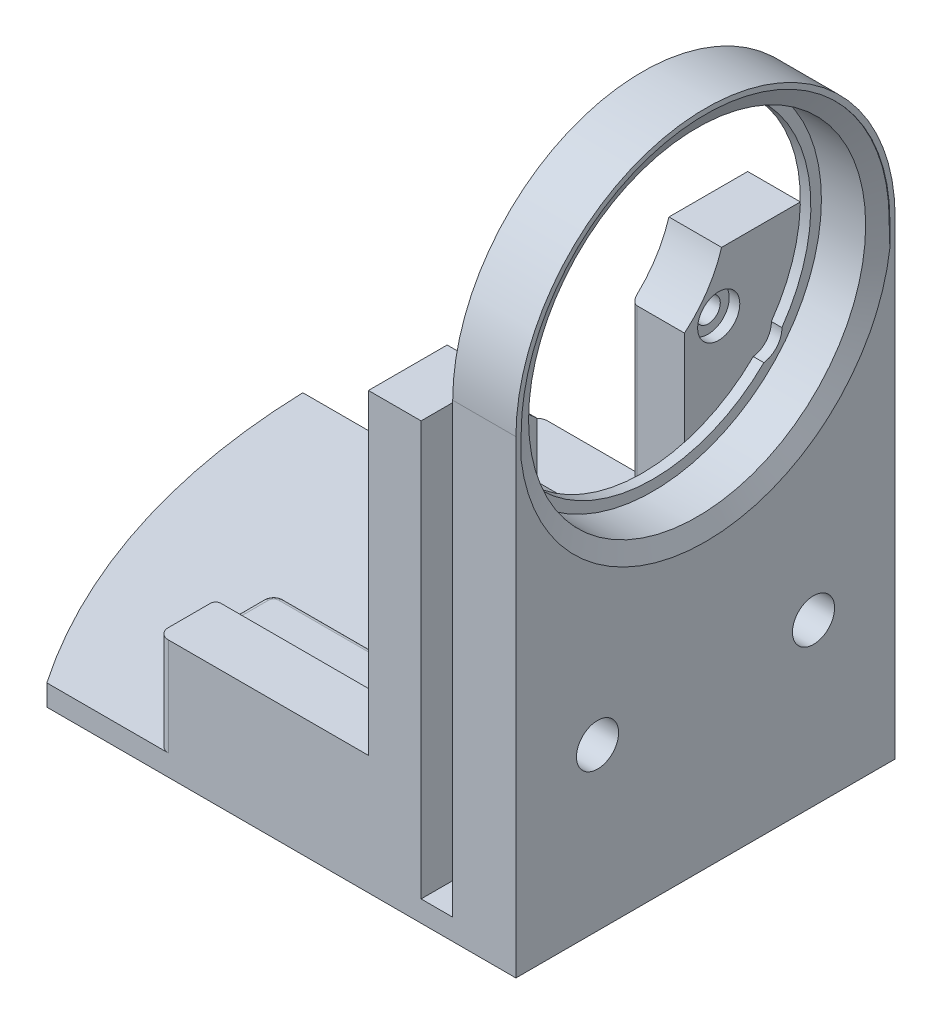
from build123d import *

# Parameters (mm, degrees)
EXTRUDE_1_DEPTH     = 2
SKETCH_2_W          = 6
SKETCH_2_H          = 35
EXTRUDE_2_DEPTH     = 60
FILLET_1_R          = 17.5
SKETCH_3_R          = 16
CUT_EXTRUDE_1_DEPTH = 5
CHAMFER_1_SIZE      = 1.640243073
CHAMFER_1_SIZE_2    = 0.8
SKETCH_4_R          = 15
CUT_EXTRUDE_2_DEPTH = 105.385422037
SKETCH_5_W          = 25
SKETCH_5_H          = 10.5
EXTRUDE_3_DEPTH     = 7.3
EXTRUDE_4_DEPTH     = 2
FILLET_2_R          = 1
EXTRUDE_5_DEPTH     = 5
SKETCH_9_R          = 1.15
CUT_EXTRUDE_3_DEPTH = 101.277297201
SKETCH_10_R         = 2
CUT_EXTRUDE_4_DEPTH = 10
FILLET_3_R          = 0.5
SKETCH_12_W         = 56.21
SKETCH_12_H         = 29.03
CUT_EXTRUDE_5_DEPTH = 113.159332301
BOSS_EXTRUDE1_DEPTH = 6
BOSS_EXTRUDE2_DEPTH = 0.5
BOSS_EXTRUDE3_DEPTH = 0.5
SKETCH5_W           = 0.5
SKETCH5_H           = 2
BOSS_EXTRUDE4_DEPTH = 2
CUT_EXTRUDE1_DEPTH  = 9
SKETCH6_W           = 1
SKETCH6_H           = 9.3
BOSS_EXTRUDE5_DEPTH = 2
SKETCH7_W           = 1
SKETCH7_H           = 9.3
BOSS_EXTRUDE7_DEPTH = 3
FILLET1_R           = 1


# Some blends are built 0.0001 mm under size
with BuildPart() as part:
    # 스케치1 → 보스-돌출1 (new body)
    with BuildSketch(Plane(origin=(0, 0, 0), x_dir=(1, 0, 0), z_dir=(0, 1, 0))):
        with BuildLine():
            Line((-11.24267666, -2.527135016), (-67.45267666, -2.527135016))
            ThreePointArc((-67.45267666, -2.527135016), (-50.72671765, -44.531450868), (-11.24267666, -66.557135016))
            Line((-11.24267666, -66.557135016), (-11.24267666, -2.527135016))
        make_face()
    extrude(amount=EXTRUDE_1_DEPTH)

    # 스케치2 → 보스-돌출2 (add)
    with BuildSketch(Plane(origin=(0, 2, 0), x_dir=(1, 0, 0), z_dir=(0, 1, 0))):
        with Locations((-14.24267666, -20.027135016)):
            Rectangle(SKETCH_2_W, SKETCH_2_H)
    extrude(amount=EXTRUDE_2_DEPTH)

    # 필렛1
    fillet_1_edges = [part.edges().sort_by_distance(p)[0] for p in [
        (-14.24267666, 62, 2.527135016),
        (-14.24267666, 62, 37.527135016),
    ]]
    fillet(fillet_1_edges, radius=FILLET_1_R - 0.0001)  # a hair under: the kernel refuses the full size

    # 스케치3 → 컷-돌출1 (cut)
    with BuildSketch(Plane(origin=(-11.24267666, 0, 0), x_dir=(0, 0, -1), z_dir=(1, 0, 0))):
        with Locations((-20.027135016, 44.5)):
            Circle(SKETCH_3_R)
    extrude(amount=-CUT_EXTRUDE_1_DEPTH, mode=Mode.SUBTRACT)

    # 모따기1
    # the kernel refuses this chamfer: 1.640243073, 0.8 mm, written as the material it takes off along each edge
    with BuildSketch(Plane(origin=(-11.24267666, 44.5, 20.027135016), x_dir=(0, 0, -1), z_dir=(0, -1, 0))) as chamfer_1_piece_1:
        Polygon((16 + CHAMFER_1_SIZE, 0), (16, -CHAMFER_1_SIZE_2), (16, 0), align=None)
    revolve(axis=Axis((-11.24267666, 44.5, 20.027135016), (1, 0, 0)), mode=Mode.SUBTRACT)

    # 스케치4 → 컷-돌출2 (cut, through all)
    with BuildSketch(Plane(origin=(-16.24267666, 0, 0), x_dir=(0, 0, -1), z_dir=(1, 0, 0))):
        with Locations((-20.027135016, 44.5)):
            Circle(SKETCH_4_R)
    extrude(amount=-CUT_EXTRUDE_2_DEPTH, mode=Mode.SUBTRACT)

    # 스케치5 → 보스-돌출3 (add)
    with BuildSketch(Plane(origin=(0, 2, 0), x_dir=(1, 0, 0), z_dir=(0, 1, 0))):
        with Locations((-32.74267666, -7.777135016)):
            Rectangle(SKETCH_5_W, SKETCH_5_H)
        with Locations((-32.74267666, -32.277135016)):
            Rectangle(SKETCH_5_W, SKETCH_5_H)
    extrude(amount=EXTRUDE_3_DEPTH)

    # 스케치6 → 보스-돌출4 (add)
    with BuildSketch(Plane(origin=(0, 9.3, 0), x_dir=(1, 0, 0), z_dir=(0, 1, 0))):
        Polygon((-45.24267666, -32.527135016), (-25.24267666, -32.527135016), (-25.24267666, -27.027135016), (-20.24267666, -27.027135016), (-20.24267666, -37.527135016), (-45.24267666, -37.527135016), align=None)
        Polygon((-45.24267666, -2.527135016), (-20.24267666, -2.527135016), (-20.24267666, -13.027135016), (-25.24267666, -13.027135016), (-25.24267666, -7.527135016), (-45.24267666, -7.527135016), align=None)
    extrude(amount=EXTRUDE_4_DEPTH)

    # 필렛2
    fillet_2_edges = [part.edges().sort_by_distance(p)[0] for p in [
        (-45.24267666, 6.65, 2.527135016),
        (-45.24267666, 5.65, 13.027135016),
        (-45.24267666, 5.65, 27.027135016),
        (-45.24267666, 6.65, 37.527135016),
    ]]
    fillet(fillet_2_edges, radius=FILLET_2_R)

    # 스케치7 → 보스-돌출5 (add)
    with BuildSketch(Plane.ZY.offset(25.24267666)):
        with BuildLine():
            Line((2.527135016, 11.3), (13.027135016, 11.3))
            Line((13.027135016, 11.3), (13.027135016, 36.014718626))
            ThreePointArc((13.027135016, 36.014718626), (10.875170651, 38.397414624), (9.502877322, 41.3))
            Line((9.502877322, 41.3), (2.527135016, 41.3))
            Line((2.527135016, 41.3), (2.527135016, 11.3))
        make_face()
        with BuildLine():
            Line((37.527135016, 11.3), (27.027135016, 11.3))
            Line((27.027135016, 11.3), (27.027135016, 36.014718626))
            ThreePointArc((27.027135016, 36.014718626), (29.17909938, 38.397414624), (30.551392709, 41.3))
            Line((30.551392709, 41.3), (37.527135016, 41.3))
            Line((37.527135016, 41.3), (37.527135016, 11.3))
        make_face()
    extrude(amount=-EXTRUDE_5_DEPTH)

    # 스케치9 → 컷-돌출3 (cut, through all)
    with BuildSketch(Plane.ZY.offset(25.24267666)):
        with Locations((9.777135016, 35.8)):
            Circle(SKETCH_9_R)
        with Locations((9.777135016, 15.3)):
            Circle(SKETCH_9_R)
        with Locations((30.277135016, 15.3)):
            Circle(SKETCH_9_R)
        with Locations((30.277135016, 35.8)):
            Circle(SKETCH_9_R)
    extrude(amount=-CUT_EXTRUDE_3_DEPTH, mode=Mode.SUBTRACT)

    # 스케치10 → 컷-돌출4 (cut)
    with BuildSketch(Plane(origin=(-11.24267666, 0, 0), x_dir=(0, 0, -1), z_dir=(1, 0, 0))):
        with Locations((-30.277135016, 15.3)):
            Circle(SKETCH_10_R)
        with Locations((-9.777135016, 15.3)):
            Circle(SKETCH_10_R)
        with Locations((-9.777135016, 35.8)):
            Circle(SKETCH_10_R)
        with Locations((-30.277135016, 35.8)):
            Circle(SKETCH_10_R)
    extrude(amount=-CUT_EXTRUDE_4_DEPTH, mode=Mode.SUBTRACT)

    # 필렛3
    fillet_3_edges = [part.edges().sort_by_distance(p)[0] for p in [
        (-45.24267666, 10.3, 32.527135016),
        (-25.24267666, 22.657359313, 27.027135016),
        (-35.24267666, 9.3, 32.527135016),
        (-45.24267666, 9.3, 30.277135016),
        (-44.949783441, 9.3, 27.320028235),
        (-34.74267666, 9.3, 13.027135016),
        (-44.949783441, 9.3, 12.734241797),
        (-45.24267666, 9.3, 9.777135016),
        (-35.24267666, 9.3, 7.527135016),
        (-45.24267666, 10.3, 7.527135016),
        (-25.24267666, 22.657359313, 13.027135016),
        (-34.74267666, 9.3, 27.027135016),
    ]]
    fillet(fillet_3_edges, radius=FILLET_3_R)

    # 스케치12 → 컷-돌출5 (cut, through all)
    with BuildSketch(Plane(origin=(0, 2, 0), x_dir=(1, 0, 0), z_dir=(0, 1, 0))):
        with Locations((-39.34767666, -52.042135016)):
            Rectangle(SKETCH_12_W, SKETCH_12_H)
    extrude(amount=-CUT_EXTRUDE_5_DEPTH, mode=Mode.SUBTRACT)

    # Sketch1 → Boss-Extrude1 (add)
    with BuildSketch(Plane(origin=(-11.24267666, 0, 0), x_dir=(0, 0, -1), z_dir=(1, 0, 0))):
        with BuildLine():
            Line((-38.027135016, 42.280050522), (-38.027135016, 0))
            Line((-38.027135016, 0), (-37.527135016, 0))
            Line((-37.527135016, 0), (-37.527135016, 44.5))
            ThreePointArc((-37.527135016, 44.5), (-32.401503687, 56.874368671), (-20.027135016, 62))
            ThreePointArc((-20.027135016, 62), (-7.652766345, 56.874368671), (-2.527135016, 44.5))
            Line((-2.527135016, 44.5), (-2.527135016, 0))
            Line((-2.527135016, 0), (-2.027135016, 0))
            Line((-2.027135016, 0), (-2.027135016, 42.280050522))
            Line((-2.027135016, 42.280050522), (-2.027135016, 44.5))
            ThreePointArc((-2.027135016, 44.5), (-7.299212954, 57.227922061), (-20.027135016, 62.5))
            ThreePointArc((-20.027135016, 62.5), (-32.755057077, 57.227922061), (-38.027135016, 44.5))
            Line((-38.027135016, 44.5), (-38.027135016, 42.280050522))
        make_face()
    extrude(amount=-BOSS_EXTRUDE1_DEPTH)

    # Sketch2 → Boss-Extrude2 (add)
    with BuildSketch(Plane(origin=(0, 0, 2.527135016), x_dir=(-1, 0, 0), z_dir=(0, 0, -1))):
        Polygon((17.24267666, 2), (17.24267666, 0), (67.45267666, 0), (67.45267666, 2), (44.24267666, 2), (44.24267666, 11.3), (25.24267666, 11.3), (25.24267666, 41.3), (20.24267666, 41.3), (20.24267666, 2), align=None)
    extrude(amount=BOSS_EXTRUDE2_DEPTH)

    # Sketch3 → Boss-Extrude3 (add)
    with BuildSketch(Plane.XY.offset(37.527135016)):
        Polygon((-17.24267666, 0), (-17.24267666, 2), (-20.24267666, 2), (-20.24267666, 41.3), (-25.24267666, 41.3), (-25.24267666, 11.3), (-44.24267666, 11.3), (-44.24267666, 2), (-56.106720966, 2), (-56.106720966, 0), align=None)
    extrude(amount=BOSS_EXTRUDE3_DEPTH)

    # Sketch5 → Boss-Extrude4 (add)
    with BuildSketch(Plane.ZY.offset(67.45267666)):
        with Locations((2.277135016, 1)):
            Rectangle(SKETCH5_W, SKETCH5_H)
    extrude(amount=BOSS_EXTRUDE4_DEPTH)

    # Sketch4 → Cut-Extrude1 (cut)
    with BuildSketch(Plane.XZ):
        with BuildLine():
            Line((-67.498191683, 0.494084527), (-93.58337569, -4.753226021))
            Line((-93.58337569, -4.753226021), (-77.452778633, 44.072890783))
            Line((-77.452778633, 44.072890783), (-53.718589474, 40.872523105))
            ThreePointArc((-53.718589474, 40.872523105), (-63.882560875, 21.800651733), (-67.498191683, 0.494084527))
        make_face()
    extrude(amount=-CUT_EXTRUDE1_DEPTH, mode=Mode.SUBTRACT)

    # Sketch6 → Boss-Extrude5 (add)
    with BuildSketch(Plane.XY.offset(38.027135016)):
        with Locations((-44.74267666, 6.65)):
            Rectangle(SKETCH6_W, SKETCH6_H)
    extrude(amount=-BOSS_EXTRUDE5_DEPTH)

    # Sketch7 → Boss-Extrude7 (add)
    with BuildSketch(Plane(origin=(0, 0, 2.027135016), x_dir=(-1, 0, 0), z_dir=(0, 0, -1))):
        with Locations((44.74267666, 6.65)):
            Rectangle(SKETCH7_W, SKETCH7_H)
    extrude(amount=-BOSS_EXTRUDE7_DEPTH)

    # Fillet1
    fillet1_edges = [part.edges().sort_by_distance(p)[0] for p in [
        (-45.24267666, 6.65, 38.027135016),
        (-45.24267666, 6.65, 2.027135016),
    ]]
    fillet(fillet1_edges, radius=FILLET1_R)


solid = part.part
